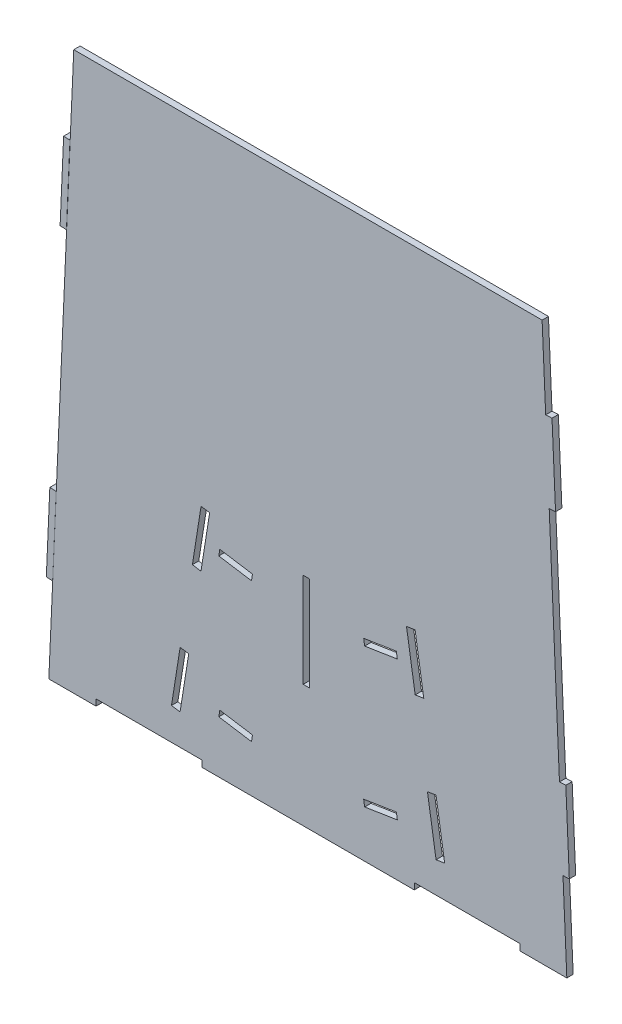
from build123d import *

# Parameters (mm, degrees)
BOSS_EXTRUDE1_DEPTH = 1.524
BOSS_EXTRUDE2_DEPTH = 1.524
SKETCH6_W           = 25.4
SKETCH6_H           = 1.524
CUT_EXTRUDE3_DEPTH  = 1.524
SKETCH7_W           = 1.524
SKETCH7_H           = 22.658950817
CUT_EXTRUDE4_DEPTH  = 1.524


with BuildPart() as part:
    # Sketch1 → Boss-Extrude1 (new body)
    with BuildSketch(Plane.XY):
        Polygon((-56.120792622, 120.430311126), (-62.105258265, -13.26978038), (62.142082471, -13.26978038), (56.212958794, 120.430311126), align=None)
    extrude(amount=BOSS_EXTRUDE1_DEPTH)

    # Sketch2 → Boss-Extrude2 (add)
    with BuildSketch(Plane.XY.offset(1.524)):
        Polygon((-62.70469272, 7.612691153), (-61.860722425, 26.643986803), (-60.338218773, 26.57646918), (-61.182189068, 7.545173529), align=None)
        Polygon((57.910805773, 82.144333492), (59.433309425, 82.211851115), (58.589339131, 101.243146766), (57.066835478, 101.175629142), align=None)
        Polygon((61.219013274, 7.545173529), (62.741516926, 7.612691153), (61.897546632, 26.643986803), (60.375042979, 26.57646918), align=None)
        Polygon((-59.396485219, 82.211851115), (-58.552514924, 101.243146766), (-57.030011272, 101.175629142), (-57.873981567, 82.144333492), align=None)
    extrude(amount=-BOSS_EXTRUDE2_DEPTH)


with BuildPart() as boss_extrude2_piece_1:
    # of the separate pieces the step leaves, piece 1, a body of its own (boss_extrude2_pieces)
    add(part.part.solids().sort_by_distance((-56.120792622, 120.430311126, 0))[0])

    # Sketch6 → Cut-Extrude3 (cut)
    with BuildSketch(Plane.XY.offset(1.524)):
        with Locations((38.24729306, -12.50778038)):
            Rectangle(SKETCH6_W, SKETCH6_H)
        with Locations((-38.091018839, -12.50778038)):
            Rectangle(SKETCH6_W, SKETCH6_H)
    extrude(amount=-CUT_EXTRUDE3_DEPTH, mode=Mode.SUBTRACT)

    # Sketch7 → Cut-Extrude4 (cut)
    with BuildSketch(Plane(origin=(0, 0, 0), x_dir=(-1, 0, 0), z_dir=(0, 0, -1))):
        Polygon((25.587096996, 40.859117736), (27.668066914, 27.678226873), (25.612061034, 27.353629208), (23.531091116, 40.534520072), align=None)
        Polygon((30.609989481, 9.04405059), (32.67894736, -4.060755858), (30.622941479, -4.385353523), (28.553983601, 8.719452925), align=None)
        Polygon((-30.766174148, 9.04405059), (-32.835132026, -4.060755858), (-30.779126146, -4.385353523), (-28.710168268, 8.719452925), align=None)
        Polygon((-25.743281663, 40.859117736), (-27.824251581, 27.678226873), (-25.7682457, 27.353629208), (-23.687275782, 40.534520072), align=None)
        with Locations((0.33065945, 27.440564802)):
            Rectangle(SKETCH7_W, SKETCH7_H)
        Polygon((-21.489779128, 32.661431134), (-13.649390123, 31.423607846), (-13.411728052, 32.928962535), (-21.252117057, 34.166785823), align=None)
        Polygon((-21.489779128, -0.752677345), (-13.649390123, -1.990500632), (-13.411728052, -0.485145943), (-21.252117057, 0.752677345), align=None)
        Polygon((13.493205456, -1.990500632), (13.255543385, -0.485145943), (21.09593239, 0.752677345), (21.333594462, -0.752677345), align=None)
        Polygon((13.493205456, 31.423607846), (13.255543385, 32.928962535), (21.09593239, 34.166785823), (21.333594462, 32.661431134), align=None)
    extrude(amount=-CUT_EXTRUDE4_DEPTH, mode=Mode.SUBTRACT)


with BuildPart() as boss_extrude2_piece_2:
    # of the separate pieces the step leaves, piece 2, a body of its own (boss_extrude2_pieces)
    add(part.part.solids().sort_by_distance((-59.396485219, 82.211851115, 1.524))[0])


with BuildPart() as boss_extrude2_piece_3:
    # of the separate pieces the step leaves, piece 3, a body of its own (boss_extrude2_pieces)
    add(part.part.solids().sort_by_distance((-62.70469272, 7.612691153, 1.524))[0])


solid = Compound([boss_extrude2_piece_1.part, boss_extrude2_piece_2.part, boss_extrude2_piece_3.part])
